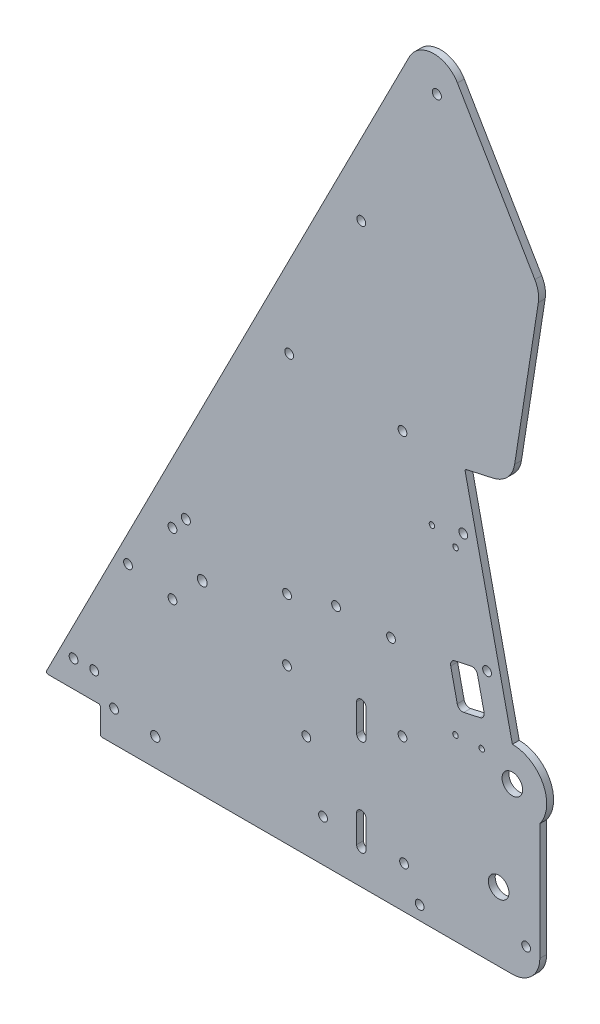
from build123d import *

# Parameters (mm, degrees)
BOSS_EXTRUDE1_DEPTH     = 3.175
SKETCH2_R               = 2.0955
SKETCH2_R_2             = 2.286
SKETCH2_R_3             = 2.032
SKETCH2_R_4             = 4.7625
CUT_EXTRUDE1_DEPTH      = 421.976111717
SKETCH7_R               = 2.159
CUT_EXTRUDE2_DEPTH      = 421.976111717
CUT_EXTRUDE3_REACH      = 422.976
SKETCH10_R              = 2.032
FILLET1_R               = 12.7
FILLET2_R               = 0.79375
SKETCH12_R              = 2.032
CUT_EXTRUDE5_DEPTH      = 410.593447353
SKETCH13_R              = 2.032
CUT_EXTRUDE6_DEPTH      = 410.593447353
CUT_EXTRUDE7_DEPTH      = 410.593447353
CUT_EXTRUDE7_DEPTH_BACK = 410.593447353
SKETCH14_R              = 1.27
SKETCH14_R_2            = 2.032
FILLET3_R               = 2.54


with BuildPart() as part:
    # Sketch1 → Boss-Extrude1 (new body)
    with BuildSketch(Plane.XY):
        with BuildLine():
            Line((228.6, -12.7), (228.6, 53.975))
            ThreePointArc((228.6, 53.975), (230.099031657, 70.599515829), (215.9, 79.375))
            Line((215.9, 79.375), (193.909735224, 178.566674323))
            Line((193.909735224, 178.566674323), (215.607913982, 183.377044743))
            Line((215.607913982, 183.377044743), (228.6, 266.7))
            Line((228.6, 266.7), (178.754725958, 351.413083686))
            Line((178.754725958, 351.413083686), (0, 0))
            Line((0, 0), (25.4, 0))
            Line((25.4, 0), (25.4, -12.7))
            Line((25.4, -12.7), (228.6, -12.7))
        make_face()
    extrude(amount=BOSS_EXTRUDE1_DEPTH)

    # Sketch2 → Cut-Extrude1 (cut, through all)
    with BuildSketch(Plane.XY.offset(3.175)):
        with Locations((64.943150167, 94.057839899)):
            Circle(SKETCH2_R)
        with Locations((180.975, 322.164313376)):
            Circle(SKETCH2_R)
        with Locations((72.544547852, 73.173171402)):
            Circle(SKETCH2_R_2)
        with Locations((193.207821773, 152.394364194)):
            Circle(SKETCH2_R_3)
        with Locations((215.9, 63.5)):
            Circle(SKETCH2_R_4)
        with Locations((173.0375, -6.35)):
            Circle(SKETCH2_R_3)
        with Locations((204.202954161, 102.798527032)):
            Circle(SKETCH2_R_3)
        with Locations((209.55, 19.05)):
            Circle(SKETCH2_R_4)
        with Locations((165.1, 179.3875)):
            Circle(SKETCH2_R_3)
        with Locations((111.724047852, 87.460671402)):
            Circle(SKETCH2_R_3)
        with Locations((111.724047852, 58.885671402)):
            Circle(SKETCH2_R_3)
        with Locations((58.765047852, 58.885671402)):
            Circle(SKETCH2_R_3)
        with Locations((58.765047852, 87.460671402)):
            Circle(SKETCH2_R_3)
    extrude(amount=-CUT_EXTRUDE1_DEPTH, mode=Mode.SUBTRACT)

    # Sketch7 → Cut-Extrude2 (cut, through all)
    with BuildSketch(Plane.XY.offset(3.175)):
        with Locations((50.8, 0)):
            Circle(SKETCH7_R)
        with BuildLine():
            Line((143.891, 3.175), (143.891, 15.875))
            ThreePointArc((143.891, 15.875), (146.05, 18.034), (148.209, 15.875))
            Line((148.209, 15.875), (148.209, 3.175))
            ThreePointArc((148.209, 3.175), (146.05, 1.016), (143.891, 3.175))
        make_face()
        with BuildLine():
            Line((143.891, 47.625), (143.891, 60.325))
            ThreePointArc((143.891, 60.325), (146.05, 62.484), (148.209, 60.325))
            Line((148.209, 60.325), (148.209, 47.625))
            ThreePointArc((148.209, 47.625), (146.05, 45.466), (143.891, 47.625))
        make_face()
    extrude(amount=-CUT_EXTRUDE2_DEPTH, mode=Mode.SUBTRACT)

    # Sketch10 → Cut-Extrude3 (cut, up to next)
    with BuildSketch(Plane.XY.offset(3.175), mode=Mode.PRIVATE) as cut_extrude3_sk1:
        with Locations((120.65, 34.925)):
            Circle(SKETCH10_R)
    cut_extrude3_tool1 = extrude(cut_extrude3_sk1.sketch, amount=-CUT_EXTRUDE3_REACH, mode=Mode.PRIVATE) & part.part
    # Sketch10 → Cut-Extrude3 (cut, up to next)
    with BuildSketch(Plane.XY.offset(3.175), mode=Mode.PRIVATE) as cut_extrude3_sk2:
        with Locations((165.1, 57.15)):
            Circle(SKETCH10_R)
    cut_extrude3_tool2 = extrude(cut_extrude3_sk2.sketch, amount=-CUT_EXTRUDE3_REACH, mode=Mode.PRIVATE) & part.part
    # Sketch10 → Cut-Extrude3 (cut, up to next)
    with BuildSketch(Plane.XY.offset(3.175), mode=Mode.PRIVATE) as cut_extrude3_sk3:
        with Locations((13.046467246, 12.334704411)):
            Circle(SKETCH10_R)
    cut_extrude3_tool3 = extrude(cut_extrude3_sk3.sketch, amount=-CUT_EXTRUDE3_REACH, mode=Mode.PRIVATE) & part.part
    # Sketch10 → Cut-Extrude3 (cut, up to next)
    with BuildSketch(Plane.XY.offset(3.175), mode=Mode.PRIVATE) as cut_extrude3_sk4:
        with Locations((22.571467246, 12.334704411)):
            Circle(SKETCH10_R)
    cut_extrude3_tool4 = extrude(cut_extrude3_sk4.sketch, amount=-CUT_EXTRUDE3_REACH, mode=Mode.PRIVATE) & part.part
    # Sketch10 → Cut-Extrude3 (cut, up to next)
    with BuildSketch(Plane.XY.offset(3.175), mode=Mode.PRIVATE) as cut_extrude3_sk5:
        with Locations((38.211447917, 62.639810909)):
            Circle(SKETCH10_R)
    cut_extrude3_tool5 = extrude(cut_extrude3_sk5.sketch, amount=-CUT_EXTRUDE3_REACH, mode=Mode.PRIVATE) & part.part
    add(cut_extrude3_tool1.solids().sort_by_distance((120.65, 34.925, 3.175))[0], mode=Mode.SUBTRACT)
    add(cut_extrude3_tool2.solids().sort_by_distance((165.1, 57.15, 3.175))[0], mode=Mode.SUBTRACT)
    add(cut_extrude3_tool3.solids().sort_by_distance((13.046467, 12.334704, 3.175))[0], mode=Mode.SUBTRACT)
    add(cut_extrude3_tool4.solids().sort_by_distance((22.571467, 12.334704, 3.175))[0], mode=Mode.SUBTRACT)
    add(cut_extrude3_tool5.solids().sort_by_distance((38.211448, 62.639811, 3.175))[0], mode=Mode.SUBTRACT)

    # Fillet1
    fillet1_edges = [part.edges().sort_by_distance(p)[0] for p in [
        (228.6, -12.7, 1.5875),
        (178.754725958, 351.413083686, 1.5875),
        (215.607913982, 183.377044743, 1.5875),
        (228.6, 266.7, 1.5875),
    ]]
    fillet(fillet1_edges, radius=FILLET1_R)

    # Fillet2
    fillet2_edges = [part.edges().sort_by_distance(p)[0] for p in [
        (25.4, -12.7, 1.5875),
        (25.4, 0, 1.5875),
        (193.909735224, 178.566674323, 1.5875),
        (0, 0, 1.5875),
    ]]
    fillet(fillet2_edges, radius=FILLET2_R)

    # Sketch12 → Cut-Extrude5 (cut, through all)
    with BuildSketch(Plane.XY.offset(3.175)):
        with Locations((31.75, 1.5875)):
            Circle(SKETCH12_R)
        with Locations((173.0375, -6.35)):
            Circle(SKETCH12_R)
        with Locations((222.25, 1.5875)):
            Circle(SKETCH12_R)
    extrude(amount=-CUT_EXTRUDE5_DEPTH, mode=Mode.SUBTRACT)

    # Sketch13 → Cut-Extrude6 (cut, through all)
    with BuildSketch(Plane.XY.offset(3.175)):
        with Locations((112.7125, 184.15)):
            Circle(SKETCH13_R)
        with Locations((146.05, 254)):
            Circle(SKETCH13_R)
    extrude(amount=-CUT_EXTRUDE6_DEPTH, mode=Mode.SUBTRACT)

    # Sketch14 → Cut-Extrude7 (cut, two sides: drawn at the far end of the back side and taken through both)
    with BuildSketch(Plane.XY.offset(3.175).offset(-CUT_EXTRUDE7_DEPTH_BACK)):
        with Locations((189.602197334, 69.980636704)):
            Circle(SKETCH14_R)
        with Locations((201.708862449, 70.509225118)):
            Circle(SKETCH14_R)
        with Locations((159.793547852, 93.98)):
            Circle(SKETCH14_R_2)
        with Locations((134.393547852, 93.98)):
            Circle(SKETCH14_R_2)
        with Locations((178.721644858, 148.532438598)):
            Circle(SKETCH14_R)
        with Locations((189.622629605, 145.09537131)):
            Circle(SKETCH14_R)
        with Locations((128.361047852, 6.6675)):
            Circle(SKETCH14_R_2)
        with Locations((165.826047852, 6.6675)):
            Circle(SKETCH14_R_2)
        Polygon((186.844411154, 98.950230697), (199.243370445, 101.699013794), (203.36654509, 83.100574858), (190.9675858, 80.351791761), align=None)
    extrude(amount=CUT_EXTRUDE7_DEPTH + CUT_EXTRUDE7_DEPTH_BACK, mode=Mode.SUBTRACT)

    # Fillet3
    fillet3_edges = [part.edges().sort_by_distance(p)[0] for p in [
        (199.243370445, 101.699013794, 1.5875),
        (186.844411154, 98.950230697, 1.5875),
        (190.9675858, 80.351791761, 1.5875),
        (203.36654509, 83.100574858, 1.5875),
    ]]
    fillet(fillet3_edges, radius=FILLET3_R)


solid = part.part
